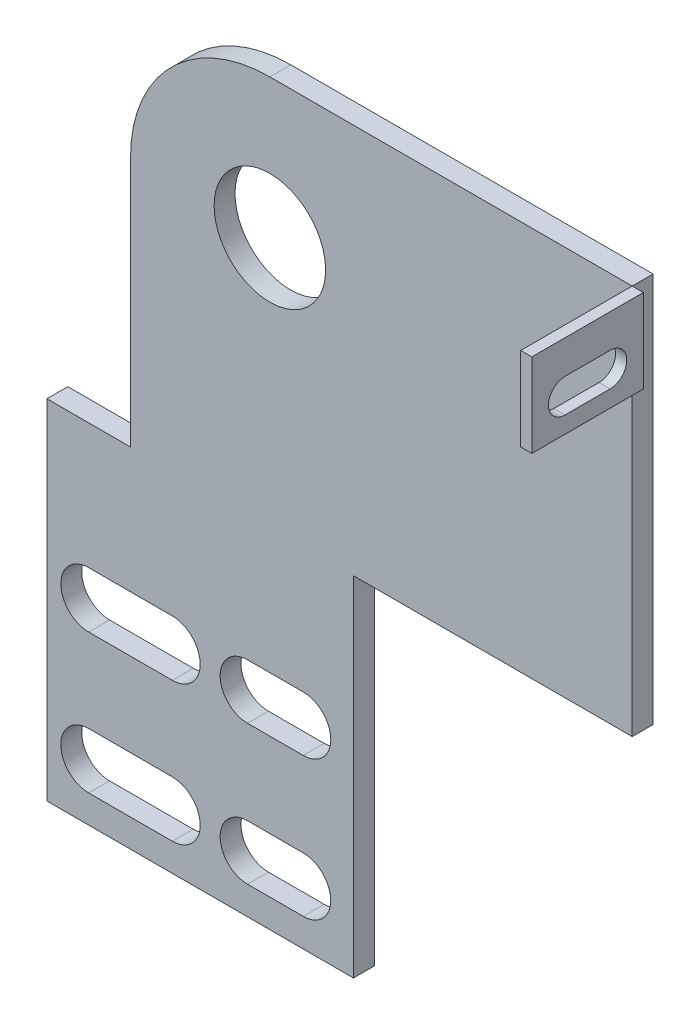
from build123d import *

# Parameters (mm, degrees)
SKETCH1_W           = 133.35
SKETCH1_H           = 168.275
BOSS_EXTRUDE1_DEPTH = 4.7625
SKETCH2_OUTSIDE_W   = 178.302
SKETCH2_OUTSIDE_H   = 213.227
SKETCH2_OUTSIDE_R   = 12.7
CUT_EXTRUDE1_DEPTH  = 215.758886967
SKETCH3_W           = 25.4
SKETCH3_H           = 19.05
BOSS_EXTRUDE2_DEPTH = 2.54


with BuildPart() as part:
    # Sketch1 → Boss-Extrude1 (new body)
    with BuildSketch(Plane.XY):
        with Locations((66.675, 84.1375)):
            Rectangle(SKETCH1_W, SKETCH1_H)
    extrude(amount=BOSS_EXTRUDE1_DEPTH)

    # Sketch2 outside → Cut-Extrude1 (cut, through all)
    # profile 1 of 6: a face of its own
    with BuildSketch(Plane.XY):
        with Locations((66.675, 84.1375)):
            Rectangle(SKETCH2_OUTSIDE_W, SKETCH2_OUTSIDE_H)
        with BuildLine():
            Line((0, 79.375), (19.05, 79.375))
            Line((19.05, 79.375), (19.05, 136.525))
            ThreePointArc((19.05, 136.525), (28.349359697, 158.975640303), (50.8, 168.275))
            Line((50.8, 168.275), (133.35, 168.275))
            Line((133.35, 168.275), (133.35, 79.375))
            Line((133.35, 79.375), (69.85, 79.375))
            Line((69.85, 79.375), (69.85, 0))
            Line((69.85, 0), (0, 0))
            Line((0, 0), (0, 79.375))
        make_face(mode=Mode.SUBTRACT)
    # profile 2 of 6: a face of its own
    with BuildSketch(Plane.XY):
        with Locations((50.8, 136.525)):
            Circle(SKETCH2_OUTSIDE_R)
    # profile 3 of 6: a face of its own
    with BuildSketch(Plane.XY):
        with BuildLine():
            Line((9.525, 50.8), (28.575, 50.8))
            ThreePointArc((28.575, 50.8), (34.925, 44.45), (28.575, 38.1))
            Line((28.575, 38.1), (9.525, 38.1))
            ThreePointArc((9.525, 38.1), (3.175, 44.45), (9.525, 50.8))
        make_face()
    # profile 4 of 6: a face of its own
    with BuildSketch(Plane.XY):
        with BuildLine():
            Line((9.525, 19.05), (28.575, 19.05))
            ThreePointArc((28.575, 19.05), (34.925, 12.7), (28.575, 6.35))
            Line((28.575, 6.35), (9.525, 6.35))
            ThreePointArc((9.525, 6.35), (3.175, 12.7), (9.525, 19.05))
        make_face()
    # profile 5 of 6: a face of its own
    with BuildSketch(Plane.XY):
        with BuildLine():
            Line((45.72, 50.708973433), (58.42, 50.708973433))
            ThreePointArc((58.42, 50.708973433), (64.678973433, 44.45), (58.42, 38.191026567))
            Line((58.42, 38.191026567), (45.72, 38.191026567))
            ThreePointArc((45.72, 38.191026567), (39.461026567, 44.45), (45.72, 50.708973433))
        make_face()
    # profile 6 of 6: a face of its own
    with BuildSketch(Plane.XY):
        with BuildLine():
            Line((45.72, 18.958973433), (58.42, 18.958973433))
            ThreePointArc((58.42, 18.958973433), (64.678973433, 12.7), (58.42, 6.441026567))
            Line((58.42, 6.441026567), (45.72, 6.441026567))
            ThreePointArc((45.72, 6.441026567), (39.461026567, 12.7), (45.72, 18.958973433))
        make_face()
    extrude(amount=CUT_EXTRUDE1_DEPTH, mode=Mode.SUBTRACT)


with BuildPart() as body_2:
    # Sketch3 → Boss-Extrude2 (new body)
    with BuildSketch(Plane(origin=(133.35, 0, 0), x_dir=(0, 0, -1), z_dir=(1, 0, 0))):
        with Locations((-17.4625, 158.75)):
            Rectangle(SKETCH3_W, SKETCH3_H)
        with BuildLine():
            Line((-22.572792052, 160.655), (-12.352207948, 160.655))
            ThreePointArc((-12.352207948, 160.655), (-8.542207948, 156.845), (-12.352207948, 153.035))
            Line((-12.352207948, 153.035), (-22.572792052, 153.035))
            ThreePointArc((-22.572792052, 153.035), (-26.382792052, 156.845), (-22.572792052, 160.655))
        make_face(mode=Mode.SUBTRACT)
    extrude(amount=BOSS_EXTRUDE2_DEPTH)


solid = Compound([part.part, body_2.part])
